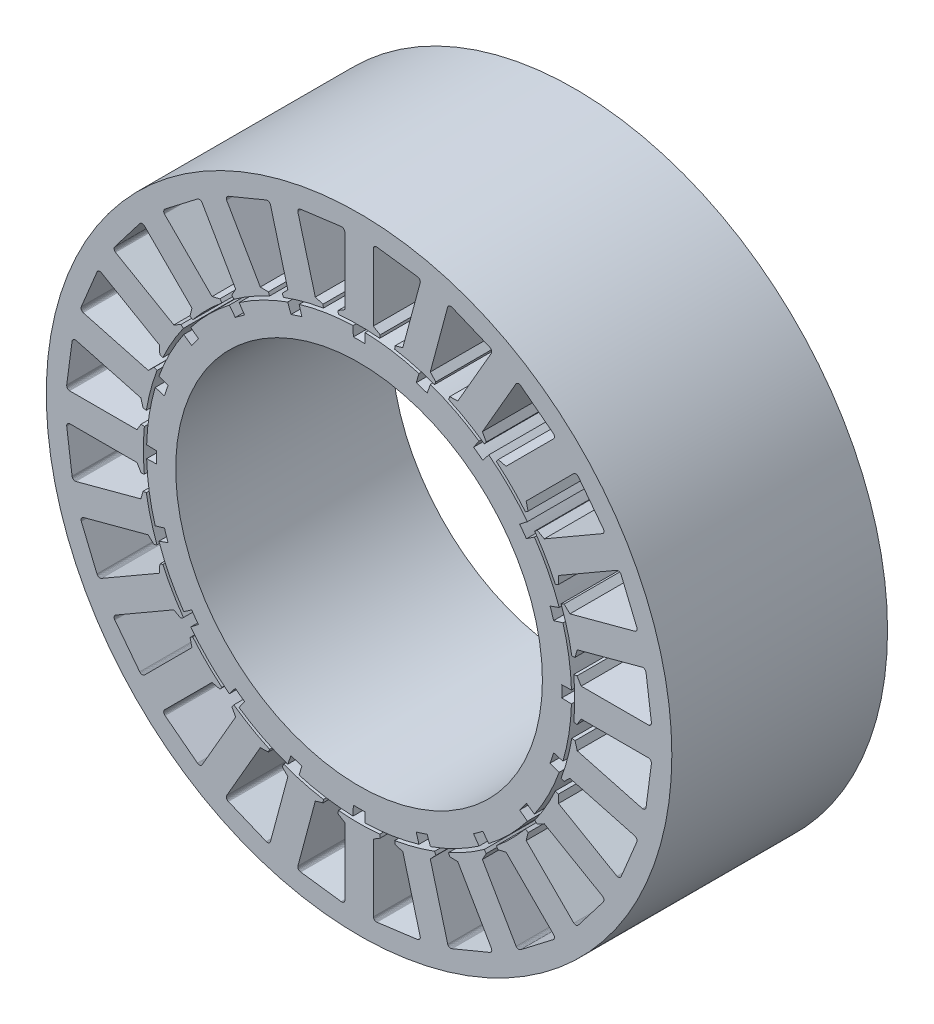
from build123d import *

# Parameters (mm, degrees)
MODEL_R               = 85
BOSS_EXTRUDE1_DEPTH   = 100
MODEL_R_2             = 145
BOSS_EXTRUDE1_2_DEPTH = 100


with BuildPart() as part:
    # Model → Boss-Extrude1 (new body)
    with BuildSketch(Plane.XY):
        with BuildLine():
            ThreePointArc((-93.962428919, 2.657433276), (-93.99060676, 1.328849428), (-94, 0))
            ThreePointArc((-94, 0), (-93.99060676, -1.328849428), (-93.962428919, -2.657433276))
            Line((-93.962428919, -2.657433276), (-98.460630304, -2.784650827))
            ThreePointArc((-98.460630304, -2.784650827), (-97.287301549, -15.408794806), (-94.502128478, -27.777647726))
            Line((-94.502128478, -27.777647726), (-90.184772354, -26.508618135))
            ThreePointArc((-90.184772354, -26.508618135), (-89.399312532, -29.047597471), (-88.542388267, -31.563356603))
            Line((-88.542388267, -31.563356603), (-92.78111962, -33.074368355))
            ThreePointArc((-92.78111962, -33.074368355), (-87.764142633, -44.718064224), (-81.293099881, -55.620876582))
            Line((-81.293099881, -55.620876582), (-77.579201917, -53.079821306))
            ThreePointArc((-77.579201917, -53.079821306), (-76.047597471, -55.251813715), (-74.455201739, -57.37963867))
            Line((-74.455201739, -57.37963867), (-78.019546504, -60.126536266))
            ThreePointArc((-78.019546504, -60.126536266), (-69.650017947, -69.650017947), (-60.126536266, -78.019546504))
            Line((-60.126536266, -78.019546504), (-57.37963867, -74.455201739))
            ThreePointArc((-57.37963867, -74.455201739), (-55.251813715, -76.047597471), (-53.079821306, -77.579201917))
            Line((-53.079821306, -77.579201917), (-55.620876582, -81.293099881))
            ThreePointArc((-55.620876582, -81.293099881), (-44.718064224, -87.764142633), (-33.074368355, -92.78111962))
            Line((-33.074368355, -92.78111962), (-31.563356603, -88.542388267))
            ThreePointArc((-31.563356603, -88.542388267), (-29.047597471, -89.399312532), (-26.508618135, -90.184772354))
            Line((-26.508618135, -90.184772354), (-27.777647726, -94.502128478))
            ThreePointArc((-27.777647726, -94.502128478), (-15.408794806, -97.287301549), (-2.784650827, -98.460630304))
            Line((-2.784650827, -98.460630304), (-2.657433276, -93.962428919))
            ThreePointArc((-2.657433276, -93.962428919), (0, -94), (2.657433276, -93.962428919))
            Line((2.657433276, -93.962428919), (2.784650827, -98.460630304))
            ThreePointArc((2.784650827, -98.460630304), (15.408794806, -97.287301549), (27.777647726, -94.502128478))
            Line((27.777647726, -94.502128478), (26.508618135, -90.184772354))
            ThreePointArc((26.508618135, -90.184772354), (29.047597471, -89.399312532), (31.563356603, -88.542388267))
            Line((31.563356603, -88.542388267), (33.074368355, -92.78111962))
            ThreePointArc((33.074368355, -92.78111962), (44.718064224, -87.764142633), (55.620876582, -81.293099881))
            Line((55.620876582, -81.293099881), (53.079821306, -77.579201917))
            ThreePointArc((53.079821306, -77.579201917), (55.251813715, -76.047597471), (57.37963867, -74.455201739))
            Line((57.37963867, -74.455201739), (60.126536266, -78.019546504))
            ThreePointArc((60.126536266, -78.019546504), (69.650017947, -69.650017947), (78.019546504, -60.126536266))
            Line((78.019546504, -60.126536266), (74.455201739, -57.37963867))
            ThreePointArc((74.455201739, -57.37963867), (76.047597471, -55.251813715), (77.579201917, -53.079821306))
            Line((77.579201917, -53.079821306), (81.293099881, -55.620876582))
            ThreePointArc((81.293099881, -55.620876582), (87.764142633, -44.718064224), (92.78111962, -33.074368355))
            Line((92.78111962, -33.074368355), (88.542388267, -31.563356603))
            ThreePointArc((88.542388267, -31.563356603), (89.399312532, -29.047597471), (90.184772354, -26.508618135))
            Line((90.184772354, -26.508618135), (94.502128478, -27.777647726))
            ThreePointArc((94.502128478, -27.777647726), (97.287301549, -15.408794806), (98.460630304, -2.784650827))
            Line((98.460630304, -2.784650827), (93.962428919, -2.657433276))
            ThreePointArc((93.962428919, -2.657433276), (94, 0), (93.962428919, 2.657433276))
            Line((93.962428919, 2.657433276), (98.460630304, 2.784650827))
            ThreePointArc((98.460630304, 2.784650827), (97.287301549, 15.408794806), (94.502128478, 27.777647726))
            Line((94.502128478, 27.777647726), (90.184772354, 26.508618135))
            ThreePointArc((90.184772354, 26.508618135), (89.399312532, 29.047597471), (88.542388267, 31.563356603))
            Line((88.542388267, 31.563356603), (92.78111962, 33.074368355))
            ThreePointArc((92.78111962, 33.074368355), (87.764142633, 44.718064224), (81.293099881, 55.620876582))
            Line((81.293099881, 55.620876582), (77.579201917, 53.079821306))
            ThreePointArc((77.579201917, 53.079821306), (76.047597471, 55.251813715), (74.455201739, 57.37963867))
            Line((74.455201739, 57.37963867), (78.019546504, 60.126536266))
            ThreePointArc((78.019546504, 60.126536266), (69.650017947, 69.650017947), (60.126536266, 78.019546504))
            Line((60.126536266, 78.019546504), (57.37963867, 74.455201739))
            ThreePointArc((57.37963867, 74.455201739), (55.251813715, 76.047597471), (53.079821306, 77.579201917))
            Line((53.079821306, 77.579201917), (55.620876582, 81.293099881))
            ThreePointArc((55.620876582, 81.293099881), (44.718064224, 87.764142633), (33.074368355, 92.78111962))
            Line((33.074368355, 92.78111962), (31.563356603, 88.542388267))
            ThreePointArc((31.563356603, 88.542388267), (29.047597471, 89.399312532), (26.508618135, 90.184772354))
            Line((26.508618135, 90.184772354), (27.777647726, 94.502128478))
            ThreePointArc((27.777647726, 94.502128478), (15.408794806, 97.287301549), (2.784650827, 98.460630304))
            Line((2.784650827, 98.460630304), (2.657433276, 93.962428919))
            ThreePointArc((2.657433276, 93.962428919), (0, 94), (-2.657433276, 93.962428919))
            Line((-2.657433276, 93.962428919), (-2.784650827, 98.460630304))
            ThreePointArc((-2.784650827, 98.460630304), (-15.408794806, 97.287301549), (-27.777647726, 94.502128478))
            Line((-27.777647726, 94.502128478), (-26.508618135, 90.184772354))
            ThreePointArc((-26.508618135, 90.184772354), (-29.047597471, 89.399312532), (-31.563356603, 88.542388267))
            Line((-31.563356603, 88.542388267), (-33.074368355, 92.78111962))
            ThreePointArc((-33.074368355, 92.78111962), (-44.718064224, 87.764142633), (-55.620876582, 81.293099881))
            Line((-55.620876582, 81.293099881), (-53.079821306, 77.579201917))
            ThreePointArc((-53.079821306, 77.579201917), (-55.251813715, 76.047597471), (-57.37963867, 74.455201739))
            Line((-57.37963867, 74.455201739), (-60.126536266, 78.019546504))
            ThreePointArc((-60.126536266, 78.019546504), (-69.650017947, 69.650017947), (-78.019546504, 60.126536266))
            Line((-78.019546504, 60.126536266), (-74.455201739, 57.37963867))
            ThreePointArc((-74.455201739, 57.37963867), (-76.047597471, 55.251813715), (-77.579201917, 53.079821306))
            Line((-77.579201917, 53.079821306), (-81.293099881, 55.620876582))
            ThreePointArc((-81.293099881, 55.620876582), (-87.764142633, 44.718064224), (-92.78111962, 33.074368355))
            Line((-92.78111962, 33.074368355), (-88.542388267, 31.563356603))
            ThreePointArc((-88.542388267, 31.563356603), (-89.399312532, 29.047597471), (-90.184772354, 26.508618135))
            Line((-90.184772354, 26.508618135), (-94.502128478, 27.777647726))
            ThreePointArc((-94.502128478, 27.777647726), (-97.287301549, 15.408794806), (-98.460630304, 2.784650827))
            Line((-98.460630304, 2.784650827), (-93.962428919, 2.657433276))
        make_face()
        Circle(MODEL_R, mode=Mode.SUBTRACT)
    extrude(amount=BOSS_EXTRUDE1_DEPTH)


with BuildPart() as body_2:
    # Model → Boss-Extrude1 2 (new body)
    with BuildSketch(Plane.XY):
        Circle(MODEL_R_2)
        with BuildLine():
            Line((43.065771994, 128.759399467), (60.594545091, 121.498743919))
            Line((60.594545091, 121.498743919), (60.888526886, 121.336265924))
            Line((60.888526886, 121.336265924), (61.138983189, 121.112444487))
            Line((61.138983189, 121.112444487), (61.333355075, 120.838502951))
            Line((61.333355075, 120.838502951), (61.461895925, 120.528177888))
            Line((61.461895925, 120.528177888), (61.518160165, 120.197030291))
            Line((61.518160165, 120.197030291), (61.49932647, 119.861665286))
            Line((61.49932647, 119.861665286), (61.406339241, 119.538899472))
            Line((61.406339241, 119.538899472), (45.772590352, 92.460452083))
            Line((45.772590352, 92.460452083), (42.052500206, 92.377775575))
            Line((42.052500206, 92.377775575), (41.478475057, 90.991956276))
            ThreePointArc((41.478475057, 90.991956276), (50, 86.602540378), (58.062108146, 81.417391248))
            Line((58.062108146, 81.417391248), (58.97525029, 82.607421258))
            Line((58.97525029, 82.607421258), (57.186805174, 85.870452083))
            Line((57.186805174, 85.870452083), (72.820554063, 112.948899472))
            Line((72.820554063, 112.948899472), (73.053583842, 113.190811681))
            Line((73.053583842, 113.190811681), (73.334601609, 113.374804642))
            Line((73.334601609, 113.374804642), (73.64951596, 113.49165218))
            Line((73.64951596, 113.49165218), (73.982535773, 113.53549507))
            Line((73.982535773, 113.53549507), (74.316962046, 113.504134847))
            Line((74.316962046, 113.504134847), (74.636025247, 113.399144045))
            Line((74.636025247, 113.399144045), (74.923726217, 113.225787339))
            Line((74.923726217, 113.225787339), (89.976024918, 101.675752315))
            Line((89.976024918, 101.675752315), (90.217937127, 101.442722535))
            Line((90.217937127, 101.442722535), (90.401930088, 101.161704768))
            Line((90.401930088, 101.161704768), (90.518777625, 100.846790417))
            Line((90.518777625, 100.846790417), (90.562620515, 100.513770604))
            Line((90.562620515, 100.513770604), (90.531260293, 100.179344331))
            Line((90.531260293, 100.179344331), (90.42626949, 99.86028113))
            Line((90.42626949, 99.86028113), (90.252912785, 99.572580161))
            Line((90.252912785, 99.572580161), (68.143453075, 77.463120451))
            Line((68.143453075, 77.463120451), (64.528723672, 78.346091255))
            Line((64.528723672, 78.346091255), (63.615581528, 77.156061245))
            ThreePointArc((63.615581528, 77.156061245), (70.710678119, 70.710678119), (77.156061245, 63.615581528))
            Line((77.156061245, 63.615581528), (78.346091255, 64.528723672))
            Line((78.346091255, 64.528723672), (77.463120451, 68.143453075))
            Line((77.463120451, 68.143453075), (99.572580161, 90.252912785))
            Line((99.572580161, 90.252912785), (99.86028113, 90.42626949))
            Line((99.86028113, 90.42626949), (100.179344331, 90.531260293))
            Line((100.179344331, 90.531260293), (100.513770604, 90.562620515))
            Line((100.513770604, 90.562620515), (100.846790417, 90.518777625))
            Line((100.846790417, 90.518777625), (101.161704768, 90.401930088))
            Line((101.161704768, 90.401930088), (101.442722535, 90.217937127))
            Line((101.442722535, 90.217937127), (101.675752315, 89.976024918))
            Line((101.675752315, 89.976024918), (113.225787339, 74.923726217))
            Line((113.225787339, 74.923726217), (113.399144045, 74.636025247))
            Line((113.399144045, 74.636025247), (113.504134847, 74.316962046))
            Line((113.504134847, 74.316962046), (113.53549507, 73.982535773))
            Line((113.53549507, 73.982535773), (113.49165218, 73.64951596))
            Line((113.49165218, 73.64951596), (113.374804642, 73.334601609))
            Line((113.374804642, 73.334601609), (113.190811681, 73.053583842))
            Line((113.190811681, 73.053583842), (112.948899472, 72.820554063))
            Line((112.948899472, 72.820554063), (85.870452083, 57.186805174))
            Line((85.870452083, 57.186805174), (82.607421258, 58.97525029))
            Line((82.607421258, 58.97525029), (81.417391248, 58.062108146))
            ThreePointArc((81.417391248, 58.062108146), (86.602540378, 50), (90.991956276, 41.478475057))
            Line((90.991956276, 41.478475057), (92.377775575, 42.052500206))
            Line((92.377775575, 42.052500206), (92.460452083, 45.772590352))
            Line((92.460452083, 45.772590352), (119.538899472, 61.406339241))
            Line((119.538899472, 61.406339241), (119.861665286, 61.49932647))
            Line((119.861665286, 61.49932647), (120.197030291, 61.518160165))
            Line((120.197030291, 61.518160165), (120.528177888, 61.461895925))
            Line((120.528177888, 61.461895925), (120.838502951, 61.333355075))
            Line((120.838502951, 61.333355075), (121.112444487, 61.138983189))
            Line((121.112444487, 61.138983189), (121.336265924, 60.888526886))
            Line((121.336265924, 60.888526886), (121.498743919, 60.594545091))
            Line((121.498743919, 60.594545091), (128.759399467, 43.065771994))
            Line((128.759399467, 43.065771994), (128.852386696, 42.743006181))
            Line((128.852386696, 42.743006181), (128.871220391, 42.407641175))
            Line((128.871220391, 42.407641175), (128.814956152, 42.076493579))
            Line((128.814956152, 42.076493579), (128.686415302, 41.766168515))
            Line((128.686415302, 41.766168515), (128.492043416, 41.492226979))
            Line((128.492043416, 41.492226979), (128.241587113, 41.268405542))
            Line((128.241587113, 41.268405542), (127.947605317, 41.105927547))
            Line((127.947605317, 41.105927547), (97.74552169, 33.01330363))
            Line((97.74552169, 33.01330363), (95.056559601, 35.585343478))
            Line((95.056559601, 35.585343478), (93.670740302, 35.01131833))
            ThreePointArc((93.670740302, 35.01131833), (96.592582629, 25.88190451), (98.626899858, 16.514679058))
            Line((98.626899858, 16.514679058), (100.11406715, 16.710468346))
            Line((100.11406715, 16.710468346), (101.156756704, 20.282401239))
            Line((101.156756704, 20.282401239), (131.358840332, 28.375025157))
            Line((131.358840332, 28.375025157), (131.694675033, 28.381305983))
            Line((131.694675033, 28.381305983), (132.023487272, 28.312699085))
            Line((132.023487272, 28.312699085), (132.328789031, 28.172644698))
            Line((132.328789031, 28.172644698), (132.595271204, 27.968165734))
            Line((132.595271204, 27.968165734), (132.809571263, 27.709515623))
            Line((132.809571263, 27.709515623), (132.960943308, 27.409664161))
            Line((132.960943308, 27.409664161), (133.041796912, 27.083647153))
            Line((133.041796912, 27.083647153), (135.518271307, 8.27295658))
            Line((135.518271307, 8.27295658), (135.524552134, 7.937121879))
            Line((135.524552134, 7.937121879), (135.455945235, 7.60830964))
            Line((135.455945235, 7.60830964), (135.315890848, 7.303007881))
            Line((135.315890848, 7.303007881), (135.111411885, 7.036525708))
            Line((135.111411885, 7.036525708), (134.852761774, 6.822225649))
            Line((134.852761774, 6.822225649), (134.552910312, 6.670853604))
            Line((134.552910312, 6.670853604), (134.226893304, 6.59))
            Line((134.226893304, 6.59), (102.959395526, 6.59))
            Line((102.959395526, 6.59), (101.027750496, 9.770354316))
            Line((101.027750496, 9.770354316), (99.540583204, 9.574565028))
            ThreePointArc((99.540583204, 9.574565028), (100, 0), (99.540583204, -9.574565028))
            Line((99.540583204, -9.574565028), (101.027750496, -9.770354316))
            Line((101.027750496, -9.770354316), (102.959395526, -6.59))
            Line((102.959395526, -6.59), (134.226893304, -6.59))
            Line((134.226893304, -6.59), (134.552910312, -6.670853604))
            Line((134.552910312, -6.670853604), (134.852761774, -6.822225649))
            Line((134.852761774, -6.822225649), (135.111411885, -7.036525708))
            Line((135.111411885, -7.036525708), (135.315890848, -7.303007881))
            Line((135.315890848, -7.303007881), (135.455945235, -7.60830964))
            Line((135.455945235, -7.60830964), (135.524552134, -7.937121879))
            Line((135.524552134, -7.937121879), (135.518271307, -8.27295658))
            Line((135.518271307, -8.27295658), (133.041796912, -27.083647153))
            Line((133.041796912, -27.083647153), (132.960943308, -27.409664161))
            Line((132.960943308, -27.409664161), (132.809571263, -27.709515623))
            Line((132.809571263, -27.709515623), (132.595271204, -27.968165734))
            Line((132.595271204, -27.968165734), (132.328789031, -28.172644698))
            Line((132.328789031, -28.172644698), (132.023487272, -28.312699085))
            Line((132.023487272, -28.312699085), (131.694675033, -28.381305983))
            Line((131.694675033, -28.381305983), (131.358840332, -28.375025157))
            Line((131.358840332, -28.375025157), (101.156756704, -20.282401239))
            Line((101.156756704, -20.282401239), (100.11406715, -16.710468346))
            Line((100.11406715, -16.710468346), (98.626899858, -16.514679058))
            ThreePointArc((98.626899858, -16.514679058), (96.592582629, -25.88190451), (93.670740302, -35.01131833))
            Line((93.670740302, -35.01131833), (95.056559601, -35.585343478))
            Line((95.056559601, -35.585343478), (97.74552169, -33.01330363))
            Line((97.74552169, -33.01330363), (127.947605317, -41.105927547))
            Line((127.947605317, -41.105927547), (128.241587113, -41.268405542))
            Line((128.241587113, -41.268405542), (128.492043416, -41.492226979))
            Line((128.492043416, -41.492226979), (128.686415302, -41.766168515))
            Line((128.686415302, -41.766168515), (128.814956152, -42.076493579))
            Line((128.814956152, -42.076493579), (128.871220391, -42.407641175))
            Line((128.871220391, -42.407641175), (128.852386696, -42.743006181))
            Line((128.852386696, -42.743006181), (128.759399467, -43.065771994))
            Line((128.759399467, -43.065771994), (121.498743919, -60.594545091))
            Line((121.498743919, -60.594545091), (121.336265924, -60.888526886))
            Line((121.336265924, -60.888526886), (121.112444487, -61.138983189))
            Line((121.112444487, -61.138983189), (120.838502951, -61.333355075))
            Line((120.838502951, -61.333355075), (120.528177888, -61.461895925))
            Line((120.528177888, -61.461895925), (120.197030291, -61.518160165))
            Line((120.197030291, -61.518160165), (119.861665286, -61.49932647))
            Line((119.861665286, -61.49932647), (119.538899472, -61.406339241))
            Line((119.538899472, -61.406339241), (92.460452083, -45.772590352))
            Line((92.460452083, -45.772590352), (92.377775575, -42.052500206))
            Line((92.377775575, -42.052500206), (90.991956276, -41.478475057))
            ThreePointArc((90.991956276, -41.478475057), (86.602540378, -50), (81.417391248, -58.062108146))
            Line((81.417391248, -58.062108146), (82.607421258, -58.97525029))
            Line((82.607421258, -58.97525029), (85.870452083, -57.186805174))
            Line((85.870452083, -57.186805174), (112.948899472, -72.820554063))
            Line((112.948899472, -72.820554063), (113.190811681, -73.053583842))
            Line((113.190811681, -73.053583842), (113.374804642, -73.334601609))
            Line((113.374804642, -73.334601609), (113.49165218, -73.64951596))
            Line((113.49165218, -73.64951596), (113.53549507, -73.982535773))
            Line((113.53549507, -73.982535773), (113.504134847, -74.316962046))
            Line((113.504134847, -74.316962046), (113.399144045, -74.636025247))
            Line((113.399144045, -74.636025247), (113.225787339, -74.923726217))
            Line((113.225787339, -74.923726217), (101.675752315, -89.976024918))
            Line((101.675752315, -89.976024918), (101.442722535, -90.217937127))
            Line((101.442722535, -90.217937127), (101.161704768, -90.401930088))
            Line((101.161704768, -90.401930088), (100.846790417, -90.518777625))
            Line((100.846790417, -90.518777625), (100.513770604, -90.562620515))
            Line((100.513770604, -90.562620515), (100.179344331, -90.531260293))
            Line((100.179344331, -90.531260293), (99.86028113, -90.42626949))
            Line((99.86028113, -90.42626949), (99.572580161, -90.252912785))
            Line((99.572580161, -90.252912785), (77.463120451, -68.143453075))
            Line((77.463120451, -68.143453075), (78.346091255, -64.528723672))
            Line((78.346091255, -64.528723672), (77.156061245, -63.615581528))
            ThreePointArc((77.156061245, -63.615581528), (70.710678119, -70.710678119), (63.615581528, -77.156061245))
            Line((63.615581528, -77.156061245), (64.528723672, -78.346091255))
            Line((64.528723672, -78.346091255), (68.143453075, -77.463120451))
            Line((68.143453075, -77.463120451), (90.252912785, -99.572580161))
            Line((90.252912785, -99.572580161), (90.42626949, -99.86028113))
            Line((90.42626949, -99.86028113), (90.531260293, -100.179344331))
            Line((90.531260293, -100.179344331), (90.562620515, -100.513770604))
            Line((90.562620515, -100.513770604), (90.518777625, -100.846790417))
            Line((90.518777625, -100.846790417), (90.401930088, -101.161704768))
            Line((90.401930088, -101.161704768), (90.217937127, -101.442722535))
            Line((90.217937127, -101.442722535), (89.976024918, -101.675752315))
            Line((89.976024918, -101.675752315), (74.923726217, -113.225787339))
            Line((74.923726217, -113.225787339), (74.636025247, -113.399144045))
            Line((74.636025247, -113.399144045), (74.316962046, -113.504134847))
            Line((74.316962046, -113.504134847), (73.982535773, -113.53549507))
            Line((73.982535773, -113.53549507), (73.64951596, -113.49165218))
            Line((73.64951596, -113.49165218), (73.334601609, -113.374804642))
            Line((73.334601609, -113.374804642), (73.053583842, -113.190811681))
            Line((73.053583842, -113.190811681), (72.820554063, -112.948899472))
            Line((72.820554063, -112.948899472), (57.186805174, -85.870452083))
            Line((57.186805174, -85.870452083), (58.97525029, -82.607421258))
            Line((58.97525029, -82.607421258), (58.062108146, -81.417391248))
            ThreePointArc((58.062108146, -81.417391248), (50, -86.602540378), (41.478475057, -90.991956276))
            Line((41.478475057, -90.991956276), (42.052500206, -92.377775575))
            Line((42.052500206, -92.377775575), (45.772590352, -92.460452083))
            Line((45.772590352, -92.460452083), (61.406339241, -119.538899472))
            Line((61.406339241, -119.538899472), (61.49932647, -119.861665286))
            Line((61.49932647, -119.861665286), (61.518160165, -120.197030291))
            Line((61.518160165, -120.197030291), (61.461895925, -120.528177888))
            Line((61.461895925, -120.528177888), (61.333355075, -120.838502951))
            Line((61.333355075, -120.838502951), (61.138983189, -121.112444487))
            Line((61.138983189, -121.112444487), (60.888526886, -121.336265924))
            Line((60.888526886, -121.336265924), (60.594545091, -121.498743919))
            Line((60.594545091, -121.498743919), (43.065771994, -128.759399467))
            Line((43.065771994, -128.759399467), (42.743006181, -128.852386696))
            Line((42.743006181, -128.852386696), (42.407641175, -128.871220391))
            Line((42.407641175, -128.871220391), (42.076493579, -128.814956152))
            Line((42.076493579, -128.814956152), (41.766168515, -128.686415302))
            Line((41.766168515, -128.686415302), (41.492226979, -128.492043416))
            Line((41.492226979, -128.492043416), (41.268405542, -128.241587113))
            Line((41.268405542, -128.241587113), (41.105927547, -127.947605317))
            Line((41.105927547, -127.947605317), (33.01330363, -97.74552169))
            Line((33.01330363, -97.74552169), (35.585343478, -95.056559601))
            Line((35.585343478, -95.056559601), (35.01131833, -93.670740302))
            ThreePointArc((35.01131833, -93.670740302), (25.88190451, -96.592582629), (16.514679058, -98.626899858))
            Line((16.514679058, -98.626899858), (16.710468346, -100.11406715))
            Line((16.710468346, -100.11406715), (20.282401239, -101.156756704))
            Line((20.282401239, -101.156756704), (28.375025157, -131.358840332))
            Line((28.375025157, -131.358840332), (28.381305983, -131.694675033))
            Line((28.381305983, -131.694675033), (28.312699085, -132.023487272))
            Line((28.312699085, -132.023487272), (28.172644698, -132.328789031))
            Line((28.172644698, -132.328789031), (27.968165734, -132.595271204))
            Line((27.968165734, -132.595271204), (27.709515623, -132.809571263))
            Line((27.709515623, -132.809571263), (27.409664161, -132.960943308))
            Line((27.409664161, -132.960943308), (27.083647153, -133.041796912))
            Line((27.083647153, -133.041796912), (8.27295658, -135.518271307))
            Line((8.27295658, -135.518271307), (7.937121879, -135.524552134))
            Line((7.937121879, -135.524552134), (7.60830964, -135.455945235))
            Line((7.60830964, -135.455945235), (7.303007881, -135.315890848))
            Line((7.303007881, -135.315890848), (7.036525708, -135.111411885))
            Line((7.036525708, -135.111411885), (6.822225649, -134.852761774))
            Line((6.822225649, -134.852761774), (6.670853604, -134.552910312))
            Line((6.670853604, -134.552910312), (6.59, -134.226893304))
            Line((6.59, -134.226893304), (6.59, -102.959395526))
            Line((6.59, -102.959395526), (9.770354316, -101.027750496))
            Line((9.770354316, -101.027750496), (9.574565028, -99.540583204))
            ThreePointArc((9.574565028, -99.540583204), (0, -100), (-9.574565028, -99.540583204))
            Line((-9.574565028, -99.540583204), (-9.770354316, -101.027750496))
            Line((-9.770354316, -101.027750496), (-6.59, -102.959395526))
            Line((-6.59, -102.959395526), (-6.59, -134.226893304))
            Line((-6.59, -134.226893304), (-6.670853604, -134.552910312))
            Line((-6.670853604, -134.552910312), (-6.822225649, -134.852761774))
            Line((-6.822225649, -134.852761774), (-7.036525708, -135.111411885))
            Line((-7.036525708, -135.111411885), (-7.303007881, -135.315890848))
            Line((-7.303007881, -135.315890848), (-7.60830964, -135.455945235))
            Line((-7.60830964, -135.455945235), (-7.937121879, -135.524552134))
            Line((-7.937121879, -135.524552134), (-8.27295658, -135.518271307))
            Line((-8.27295658, -135.518271307), (-27.083647153, -133.041796912))
            Line((-27.083647153, -133.041796912), (-27.409664161, -132.960943308))
            Line((-27.409664161, -132.960943308), (-27.709515623, -132.809571263))
            Line((-27.709515623, -132.809571263), (-27.968165734, -132.595271204))
            Line((-27.968165734, -132.595271204), (-28.172644698, -132.328789031))
            Line((-28.172644698, -132.328789031), (-28.312699085, -132.023487272))
            Line((-28.312699085, -132.023487272), (-28.381305983, -131.694675033))
            Line((-28.381305983, -131.694675033), (-28.375025157, -131.358840332))
            Line((-28.375025157, -131.358840332), (-20.282401239, -101.156756704))
            Line((-20.282401239, -101.156756704), (-16.710468346, -100.11406715))
            Line((-16.710468346, -100.11406715), (-16.514679058, -98.626899858))
            ThreePointArc((-16.514679058, -98.626899858), (-25.88190451, -96.592582629), (-35.01131833, -93.670740302))
            Line((-35.01131833, -93.670740302), (-35.585343478, -95.056559601))
            Line((-35.585343478, -95.056559601), (-33.01330363, -97.74552169))
            Line((-33.01330363, -97.74552169), (-41.105927547, -127.947605317))
            Line((-41.105927547, -127.947605317), (-41.268405542, -128.241587113))
            Line((-41.268405542, -128.241587113), (-41.492226979, -128.492043416))
            Line((-41.492226979, -128.492043416), (-41.766168515, -128.686415302))
            Line((-41.766168515, -128.686415302), (-42.076493579, -128.814956152))
            Line((-42.076493579, -128.814956152), (-42.407641175, -128.871220391))
            Line((-42.407641175, -128.871220391), (-42.743006181, -128.852386696))
            Line((-42.743006181, -128.852386696), (-43.065771994, -128.759399467))
            Line((-43.065771994, -128.759399467), (-60.594545091, -121.498743919))
            Line((-60.594545091, -121.498743919), (-60.888526886, -121.336265924))
            Line((-60.888526886, -121.336265924), (-61.138983189, -121.112444487))
            Line((-61.138983189, -121.112444487), (-61.333355075, -120.838502951))
            Line((-61.333355075, -120.838502951), (-61.461895925, -120.528177888))
            Line((-61.461895925, -120.528177888), (-61.518160165, -120.197030291))
            Line((-61.518160165, -120.197030291), (-61.49932647, -119.861665286))
            Line((-61.49932647, -119.861665286), (-61.406339241, -119.538899472))
            Line((-61.406339241, -119.538899472), (-45.772590352, -92.460452083))
            Line((-45.772590352, -92.460452083), (-42.052500206, -92.377775575))
            Line((-42.052500206, -92.377775575), (-41.478475057, -90.991956276))
            ThreePointArc((-41.478475057, -90.991956276), (-50, -86.602540378), (-58.062108146, -81.417391248))
            Line((-58.062108146, -81.417391248), (-58.97525029, -82.607421258))
            Line((-58.97525029, -82.607421258), (-57.186805174, -85.870452083))
            Line((-57.186805174, -85.870452083), (-72.820554063, -112.948899472))
            Line((-72.820554063, -112.948899472), (-73.053583842, -113.190811681))
            Line((-73.053583842, -113.190811681), (-73.334601609, -113.374804642))
            Line((-73.334601609, -113.374804642), (-73.64951596, -113.49165218))
            Line((-73.64951596, -113.49165218), (-73.982535773, -113.53549507))
            Line((-73.982535773, -113.53549507), (-74.316962046, -113.504134847))
            Line((-74.316962046, -113.504134847), (-74.636025247, -113.399144045))
            Line((-74.636025247, -113.399144045), (-74.923726217, -113.225787339))
            Line((-74.923726217, -113.225787339), (-89.976024918, -101.675752315))
            Line((-89.976024918, -101.675752315), (-90.217937127, -101.442722535))
            Line((-90.217937127, -101.442722535), (-90.401930088, -101.161704768))
            Line((-90.401930088, -101.161704768), (-90.518777625, -100.846790417))
            Line((-90.518777625, -100.846790417), (-90.562620515, -100.513770604))
            Line((-90.562620515, -100.513770604), (-90.531260293, -100.179344331))
            Line((-90.531260293, -100.179344331), (-90.42626949, -99.86028113))
            Line((-90.42626949, -99.86028113), (-90.252912785, -99.572580161))
            Line((-90.252912785, -99.572580161), (-68.143453075, -77.463120451))
            Line((-68.143453075, -77.463120451), (-64.528723672, -78.346091255))
            Line((-64.528723672, -78.346091255), (-63.615581528, -77.156061245))
            ThreePointArc((-63.615581528, -77.156061245), (-70.710678119, -70.710678119), (-77.156061245, -63.615581528))
            Line((-77.156061245, -63.615581528), (-78.346091255, -64.528723672))
            Line((-78.346091255, -64.528723672), (-77.463120451, -68.143453075))
            Line((-77.463120451, -68.143453075), (-99.572580161, -90.252912785))
            Line((-99.572580161, -90.252912785), (-99.86028113, -90.42626949))
            Line((-99.86028113, -90.42626949), (-100.179344331, -90.531260293))
            Line((-100.179344331, -90.531260293), (-100.513770604, -90.562620515))
            Line((-100.513770604, -90.562620515), (-100.846790417, -90.518777625))
            Line((-100.846790417, -90.518777625), (-101.161704768, -90.401930088))
            Line((-101.161704768, -90.401930088), (-101.442722535, -90.217937127))
            Line((-101.442722535, -90.217937127), (-101.675752315, -89.976024918))
            Line((-101.675752315, -89.976024918), (-113.225787339, -74.923726217))
            Line((-113.225787339, -74.923726217), (-113.399144045, -74.636025247))
            Line((-113.399144045, -74.636025247), (-113.504134847, -74.316962046))
            Line((-113.504134847, -74.316962046), (-113.53549507, -73.982535773))
            Line((-113.53549507, -73.982535773), (-113.49165218, -73.64951596))
            Line((-113.49165218, -73.64951596), (-113.374804642, -73.334601609))
            Line((-113.374804642, -73.334601609), (-113.190811681, -73.053583842))
            Line((-113.190811681, -73.053583842), (-112.948899472, -72.820554063))
            Line((-112.948899472, -72.820554063), (-85.870452083, -57.186805174))
            Line((-85.870452083, -57.186805174), (-82.607421258, -58.97525029))
            Line((-82.607421258, -58.97525029), (-81.417391248, -58.062108146))
            ThreePointArc((-81.417391248, -58.062108146), (-86.602540378, -50), (-90.991956276, -41.478475057))
            Line((-90.991956276, -41.478475057), (-92.377775575, -42.052500206))
            Line((-92.377775575, -42.052500206), (-92.460452083, -45.772590352))
            Line((-92.460452083, -45.772590352), (-119.538899472, -61.406339241))
            Line((-119.538899472, -61.406339241), (-119.861665286, -61.49932647))
            Line((-119.861665286, -61.49932647), (-120.197030291, -61.518160165))
            Line((-120.197030291, -61.518160165), (-120.528177888, -61.461895925))
            Line((-120.528177888, -61.461895925), (-120.838502951, -61.333355075))
            Line((-120.838502951, -61.333355075), (-121.112444487, -61.138983189))
            Line((-121.112444487, -61.138983189), (-121.336265924, -60.888526886))
            Line((-121.336265924, -60.888526886), (-121.498743919, -60.594545091))
            Line((-121.498743919, -60.594545091), (-128.759399467, -43.065771994))
            Line((-128.759399467, -43.065771994), (-128.852386696, -42.743006181))
            Line((-128.852386696, -42.743006181), (-128.871220391, -42.407641175))
            Line((-128.871220391, -42.407641175), (-128.814956152, -42.076493579))
            Line((-128.814956152, -42.076493579), (-128.686415302, -41.766168515))
            Line((-128.686415302, -41.766168515), (-128.492043416, -41.492226979))
            Line((-128.492043416, -41.492226979), (-128.241587113, -41.268405542))
            Line((-128.241587113, -41.268405542), (-127.947605317, -41.105927547))
            Line((-127.947605317, -41.105927547), (-97.74552169, -33.01330363))
            Line((-97.74552169, -33.01330363), (-95.056559601, -35.585343478))
            Line((-95.056559601, -35.585343478), (-93.670740302, -35.01131833))
            ThreePointArc((-93.670740302, -35.01131833), (-96.592582629, -25.88190451), (-98.626899858, -16.514679058))
            Line((-98.626899858, -16.514679058), (-100.11406715, -16.710468346))
            Line((-100.11406715, -16.710468346), (-101.156756704, -20.282401239))
            Line((-101.156756704, -20.282401239), (-131.358840332, -28.375025157))
            Line((-131.358840332, -28.375025157), (-131.694675033, -28.381305983))
            Line((-131.694675033, -28.381305983), (-132.023487272, -28.312699085))
            Line((-132.023487272, -28.312699085), (-132.328789031, -28.172644698))
            Line((-132.328789031, -28.172644698), (-132.595271204, -27.968165734))
            Line((-132.595271204, -27.968165734), (-132.809571263, -27.709515623))
            Line((-132.809571263, -27.709515623), (-132.960943308, -27.409664161))
            Line((-132.960943308, -27.409664161), (-133.041796912, -27.083647153))
            Line((-133.041796912, -27.083647153), (-135.518271307, -8.27295658))
            Line((-135.518271307, -8.27295658), (-135.524552134, -7.937121879))
            Line((-135.524552134, -7.937121879), (-135.455945235, -7.60830964))
            Line((-135.455945235, -7.60830964), (-135.315890848, -7.303007881))
            Line((-135.315890848, -7.303007881), (-135.111411885, -7.036525708))
            Line((-135.111411885, -7.036525708), (-134.852761774, -6.822225649))
            Line((-134.852761774, -6.822225649), (-134.552910312, -6.670853604))
            Line((-134.552910312, -6.670853604), (-134.226893304, -6.59))
            Line((-134.226893304, -6.59), (-102.959395526, -6.59))
            Line((-102.959395526, -6.59), (-101.027750496, -9.770354316))
            Line((-101.027750496, -9.770354316), (-99.540583204, -9.574565028))
            ThreePointArc((-99.540583204, -9.574565028), (-100, 0), (-99.540583204, 9.574565028))
            Line((-99.540583204, 9.574565028), (-101.027750496, 9.770354316))
            Line((-101.027750496, 9.770354316), (-102.959395526, 6.59))
            Line((-102.959395526, 6.59), (-134.226893304, 6.59))
            Line((-134.226893304, 6.59), (-134.552910312, 6.670853604))
            Line((-134.552910312, 6.670853604), (-134.852761774, 6.822225649))
            Line((-134.852761774, 6.822225649), (-135.111411885, 7.036525708))
            Line((-135.111411885, 7.036525708), (-135.315890848, 7.303007881))
            Line((-135.315890848, 7.303007881), (-135.455945235, 7.60830964))
            Line((-135.455945235, 7.60830964), (-135.524552134, 7.937121879))
            Line((-135.524552134, 7.937121879), (-135.518271307, 8.27295658))
            Line((-135.518271307, 8.27295658), (-133.041796912, 27.083647153))
            Line((-133.041796912, 27.083647153), (-132.960943308, 27.409664161))
            Line((-132.960943308, 27.409664161), (-132.809571263, 27.709515623))
            Line((-132.809571263, 27.709515623), (-132.595271204, 27.968165734))
            Line((-132.595271204, 27.968165734), (-132.328789031, 28.172644698))
            Line((-132.328789031, 28.172644698), (-132.023487272, 28.312699085))
            Line((-132.023487272, 28.312699085), (-131.694675033, 28.381305983))
            Line((-131.694675033, 28.381305983), (-131.358840332, 28.375025157))
            Line((-131.358840332, 28.375025157), (-101.156756704, 20.282401239))
            Line((-101.156756704, 20.282401239), (-100.11406715, 16.710468346))
            Line((-100.11406715, 16.710468346), (-98.626899858, 16.514679058))
            ThreePointArc((-98.626899858, 16.514679058), (-96.592582629, 25.88190451), (-93.670740302, 35.01131833))
            Line((-93.670740302, 35.01131833), (-95.056559601, 35.585343478))
            Line((-95.056559601, 35.585343478), (-97.74552169, 33.01330363))
            Line((-97.74552169, 33.01330363), (-127.947605317, 41.105927547))
            Line((-127.947605317, 41.105927547), (-128.241587113, 41.268405542))
            Line((-128.241587113, 41.268405542), (-128.492043416, 41.492226979))
            Line((-128.492043416, 41.492226979), (-128.686415302, 41.766168515))
            Line((-128.686415302, 41.766168515), (-128.814956152, 42.076493579))
            Line((-128.814956152, 42.076493579), (-128.871220391, 42.407641175))
            Line((-128.871220391, 42.407641175), (-128.852386696, 42.743006181))
            Line((-128.852386696, 42.743006181), (-128.759399467, 43.065771994))
            Line((-128.759399467, 43.065771994), (-121.498743919, 60.594545091))
            Line((-121.498743919, 60.594545091), (-121.336265924, 60.888526886))
            Line((-121.336265924, 60.888526886), (-121.112444487, 61.138983189))
            Line((-121.112444487, 61.138983189), (-120.838502951, 61.333355075))
            Line((-120.838502951, 61.333355075), (-120.528177888, 61.461895925))
            Line((-120.528177888, 61.461895925), (-120.197030291, 61.518160165))
            Line((-120.197030291, 61.518160165), (-119.861665286, 61.49932647))
            Line((-119.861665286, 61.49932647), (-119.538899472, 61.406339241))
            Line((-119.538899472, 61.406339241), (-92.460452083, 45.772590352))
            Line((-92.460452083, 45.772590352), (-92.377775575, 42.052500206))
            Line((-92.377775575, 42.052500206), (-90.991956276, 41.478475057))
            ThreePointArc((-90.991956276, 41.478475057), (-86.602540378, 50), (-81.417391248, 58.062108146))
            Line((-81.417391248, 58.062108146), (-82.607421258, 58.97525029))
            Line((-82.607421258, 58.97525029), (-85.870452083, 57.186805174))
            Line((-85.870452083, 57.186805174), (-112.948899472, 72.820554063))
            Line((-112.948899472, 72.820554063), (-113.190811681, 73.053583842))
            Line((-113.190811681, 73.053583842), (-113.374804642, 73.334601609))
            Line((-113.374804642, 73.334601609), (-113.49165218, 73.64951596))
            Line((-113.49165218, 73.64951596), (-113.53549507, 73.982535773))
            Line((-113.53549507, 73.982535773), (-113.504134847, 74.316962046))
            Line((-113.504134847, 74.316962046), (-113.399144045, 74.636025247))
            Line((-113.399144045, 74.636025247), (-113.225787339, 74.923726217))
            Line((-113.225787339, 74.923726217), (-101.675752315, 89.976024918))
            Line((-101.675752315, 89.976024918), (-101.442722535, 90.217937127))
            Line((-101.442722535, 90.217937127), (-101.161704768, 90.401930088))
            Line((-101.161704768, 90.401930088), (-100.846790417, 90.518777625))
            Line((-100.846790417, 90.518777625), (-100.513770604, 90.562620515))
            Line((-100.513770604, 90.562620515), (-100.179344331, 90.531260293))
            Line((-100.179344331, 90.531260293), (-99.86028113, 90.42626949))
            Line((-99.86028113, 90.42626949), (-99.572580161, 90.252912785))
            Line((-99.572580161, 90.252912785), (-77.463120451, 68.143453075))
            Line((-77.463120451, 68.143453075), (-78.346091255, 64.528723672))
            Line((-78.346091255, 64.528723672), (-77.156061245, 63.615581528))
            ThreePointArc((-77.156061245, 63.615581528), (-70.710678119, 70.710678119), (-63.615581528, 77.156061245))
            Line((-63.615581528, 77.156061245), (-64.528723672, 78.346091255))
            Line((-64.528723672, 78.346091255), (-68.143453075, 77.463120451))
            Line((-68.143453075, 77.463120451), (-90.252912785, 99.572580161))
            Line((-90.252912785, 99.572580161), (-90.42626949, 99.86028113))
            Line((-90.42626949, 99.86028113), (-90.531260293, 100.179344331))
            Line((-90.531260293, 100.179344331), (-90.562620515, 100.513770604))
            Line((-90.562620515, 100.513770604), (-90.518777625, 100.846790417))
            Line((-90.518777625, 100.846790417), (-90.401930088, 101.161704768))
            Line((-90.401930088, 101.161704768), (-90.217937127, 101.442722535))
            Line((-90.217937127, 101.442722535), (-89.976024918, 101.675752315))
            Line((-89.976024918, 101.675752315), (-74.923726217, 113.225787339))
            Line((-74.923726217, 113.225787339), (-74.636025247, 113.399144045))
            Line((-74.636025247, 113.399144045), (-74.316962046, 113.504134847))
            Line((-74.316962046, 113.504134847), (-73.982535773, 113.53549507))
            Line((-73.982535773, 113.53549507), (-73.64951596, 113.49165218))
            Line((-73.64951596, 113.49165218), (-73.334601609, 113.374804642))
            Line((-73.334601609, 113.374804642), (-73.053583842, 113.190811681))
            Line((-73.053583842, 113.190811681), (-72.820554063, 112.948899472))
            Line((-72.820554063, 112.948899472), (-57.186805174, 85.870452083))
            Line((-57.186805174, 85.870452083), (-58.97525029, 82.607421258))
            Line((-58.97525029, 82.607421258), (-58.062108146, 81.417391248))
            ThreePointArc((-58.062108146, 81.417391248), (-50, 86.602540378), (-41.478475057, 90.991956276))
            Line((-41.478475057, 90.991956276), (-42.052500206, 92.377775575))
            Line((-42.052500206, 92.377775575), (-45.772590352, 92.460452083))
            Line((-45.772590352, 92.460452083), (-61.406339241, 119.538899472))
            Line((-61.406339241, 119.538899472), (-61.49932647, 119.861665286))
            Line((-61.49932647, 119.861665286), (-61.518160165, 120.197030291))
            Line((-61.518160165, 120.197030291), (-61.461895925, 120.528177888))
            Line((-61.461895925, 120.528177888), (-61.333355075, 120.838502951))
            Line((-61.333355075, 120.838502951), (-61.138983189, 121.112444487))
            Line((-61.138983189, 121.112444487), (-60.888526886, 121.336265924))
            Line((-60.888526886, 121.336265924), (-60.594545091, 121.498743919))
            Line((-60.594545091, 121.498743919), (-43.065771994, 128.759399467))
            Line((-43.065771994, 128.759399467), (-42.743006181, 128.852386696))
            Line((-42.743006181, 128.852386696), (-42.407641175, 128.871220391))
            Line((-42.407641175, 128.871220391), (-42.076493579, 128.814956152))
            Line((-42.076493579, 128.814956152), (-41.766168515, 128.686415302))
            Line((-41.766168515, 128.686415302), (-41.492226979, 128.492043416))
            Line((-41.492226979, 128.492043416), (-41.268405542, 128.241587113))
            Line((-41.268405542, 128.241587113), (-41.105927547, 127.947605317))
            Line((-41.105927547, 127.947605317), (-33.01330363, 97.74552169))
            Line((-33.01330363, 97.74552169), (-35.585343478, 95.056559601))
            Line((-35.585343478, 95.056559601), (-35.01131833, 93.670740302))
            ThreePointArc((-35.01131833, 93.670740302), (-25.88190451, 96.592582629), (-16.514679058, 98.626899858))
            Line((-16.514679058, 98.626899858), (-16.710468346, 100.11406715))
            Line((-16.710468346, 100.11406715), (-20.282401239, 101.156756704))
            Line((-20.282401239, 101.156756704), (-28.375025157, 131.358840332))
            Line((-28.375025157, 131.358840332), (-28.381305983, 131.694675033))
            Line((-28.381305983, 131.694675033), (-28.312699085, 132.023487272))
            Line((-28.312699085, 132.023487272), (-28.172644698, 132.328789031))
            Line((-28.172644698, 132.328789031), (-27.968165734, 132.595271204))
            Line((-27.968165734, 132.595271204), (-27.709515623, 132.809571263))
            Line((-27.709515623, 132.809571263), (-27.409664161, 132.960943308))
            Line((-27.409664161, 132.960943308), (-27.083647153, 133.041796912))
            Line((-27.083647153, 133.041796912), (-8.27295658, 135.518271307))
            Line((-8.27295658, 135.518271307), (-7.937121879, 135.524552134))
            Line((-7.937121879, 135.524552134), (-7.60830964, 135.455945235))
            Line((-7.60830964, 135.455945235), (-7.303007881, 135.315890848))
            Line((-7.303007881, 135.315890848), (-7.036525708, 135.111411885))
            Line((-7.036525708, 135.111411885), (-6.822225649, 134.852761774))
            Line((-6.822225649, 134.852761774), (-6.670853604, 134.552910312))
            Line((-6.670853604, 134.552910312), (-6.59, 134.226893304))
            Line((-6.59, 134.226893304), (-6.59, 102.959395526))
            Line((-6.59, 102.959395526), (-9.770354316, 101.027750496))
            Line((-9.770354316, 101.027750496), (-9.574565028, 99.540583204))
            ThreePointArc((-9.574565028, 99.540583204), (0, 100), (9.574565028, 99.540583204))
            Line((9.574565028, 99.540583204), (9.770354316, 101.027750496))
            Line((9.770354316, 101.027750496), (6.59, 102.959395526))
            Line((6.59, 102.959395526), (6.59, 134.226893304))
            Line((6.59, 134.226893304), (6.670853604, 134.552910312))
            Line((6.670853604, 134.552910312), (6.822225649, 134.852761774))
            Line((6.822225649, 134.852761774), (7.036525708, 135.111411885))
            Line((7.036525708, 135.111411885), (7.303007881, 135.315890848))
            Line((7.303007881, 135.315890848), (7.60830964, 135.455945235))
            Line((7.60830964, 135.455945235), (7.937121879, 135.524552134))
            Line((7.937121879, 135.524552134), (8.27295658, 135.518271307))
            Line((8.27295658, 135.518271307), (27.083647153, 133.041796912))
            Line((27.083647153, 133.041796912), (27.409664161, 132.960943308))
            Line((27.409664161, 132.960943308), (27.709515623, 132.809571263))
            Line((27.709515623, 132.809571263), (27.968165734, 132.595271204))
            Line((27.968165734, 132.595271204), (28.172644698, 132.328789031))
            Line((28.172644698, 132.328789031), (28.312699085, 132.023487272))
            Line((28.312699085, 132.023487272), (28.381305983, 131.694675033))
            Line((28.381305983, 131.694675033), (28.375025157, 131.358840332))
            Line((28.375025157, 131.358840332), (20.282401239, 101.156756704))
            Line((20.282401239, 101.156756704), (16.710468346, 100.11406715))
            Line((16.710468346, 100.11406715), (16.514679058, 98.626899858))
            ThreePointArc((16.514679058, 98.626899858), (25.88190451, 96.592582629), (35.01131833, 93.670740302))
            Line((35.01131833, 93.670740302), (35.585343478, 95.056559601))
            Line((35.585343478, 95.056559601), (33.01330363, 97.74552169))
            Line((33.01330363, 97.74552169), (41.105927547, 127.947605317))
            Line((41.105927547, 127.947605317), (41.268405542, 128.241587113))
            Line((41.268405542, 128.241587113), (41.492226979, 128.492043416))
            Line((41.492226979, 128.492043416), (41.766168515, 128.686415302))
            Line((41.766168515, 128.686415302), (42.076493579, 128.814956152))
            Line((42.076493579, 128.814956152), (42.407641175, 128.871220391))
            Line((42.407641175, 128.871220391), (42.743006181, 128.852386696))
            Line((42.743006181, 128.852386696), (43.065771994, 128.759399467))
        make_face(mode=Mode.SUBTRACT)
    extrude(amount=BOSS_EXTRUDE1_2_DEPTH)


solid = Compound([part.part, body_2.part])
